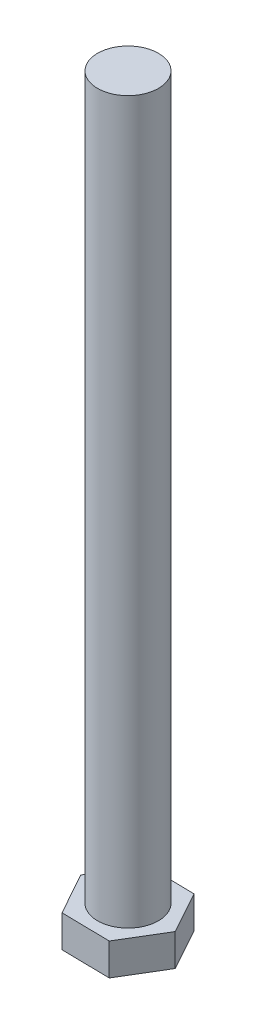
from build123d import *

# Parameters (mm, degrees)
BOSS_EXTRUDE1_DEPTH = 2
SKETCH2_R           = 1.9
BOSS_EXTRUDE2_DEPTH = 45


with BuildPart() as part:
    # Sketch1 → Boss-Extrude1 (new body)
    with BuildSketch(Plane(origin=(0, 0, 0), x_dir=(1, 0, 0), z_dir=(0, 1, 0))):
        Polygon((1.452037316, -2.62576748), (3, -0.055382537), (1.547962684, 2.570384943), (-1.452037316, 2.62576748), (-3, 0.055382537), (-1.547962684, -2.570384943), align=None)
    extrude(amount=BOSS_EXTRUDE1_DEPTH)

    # Sketch2 → Boss-Extrude2 (add)
    with BuildSketch(Plane(origin=(0, 2, 0), x_dir=(1, 0, 0), z_dir=(0, 1, 0))):
        Circle(SKETCH2_R)
    extrude(amount=BOSS_EXTRUDE2_DEPTH)


solid = part.part
